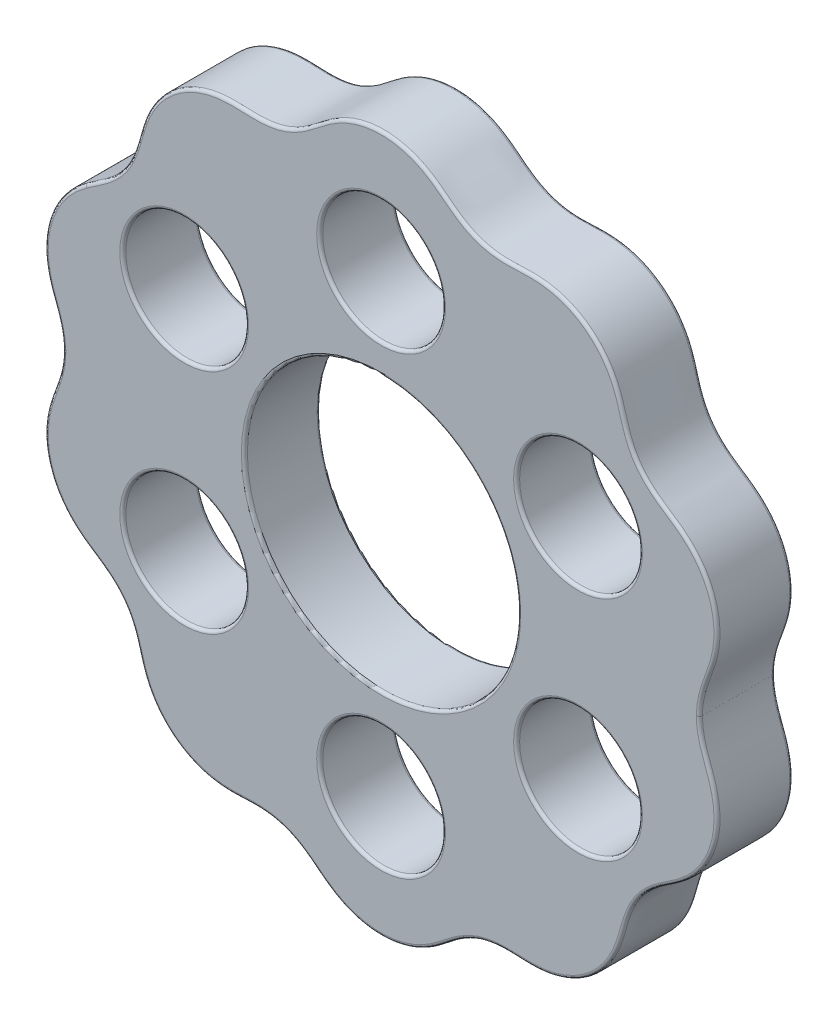
from build123d import *

# Parameters (mm, degrees)
EXTRUDE_2_OUTLINE_R   = 4.05
EXTRUDE_2_OUTLINE_R_2 = 9.025
EXTRUDE_2_DEPTH       = 5
FILLET_1_R            = 0.2


# Read off the part's stored shape, not the designer's step: 凸台-拉伸2
with BuildPart() as part:
    # 凸台-拉伸2 outline → 凸台-拉伸2 (new body)
    with BuildSketch(Plane.XY):
        with BuildLine():
            Line((21, 4.6e-08), (21, 0.003460893))
            add(Edge.make_bspline(
                [(21, 0.003460893), (21.000011266, 0.03628424), (21.00062988, 0.085518518), (21.002663687, 0.16758944), (21.008110281, 0.293673019), (21.0159383, 0.41500951), (21.03210052, 0.585956931), (21.062899635, 0.81813176), (21.111759858, 1.086790042), (21.183755453, 1.389774912), (21.269720123, 1.689533504), (21.366814407, 1.98553382), (21.47453945, 2.287562772), (21.589196835, 2.596568641), (21.735660872, 2.996140535), (21.901222759, 3.490830819), (22.05369515, 4.080881586), (22.165923512, 4.849511492), (22.175561982, 5.707357428), (22.040932637, 6.638885107), (21.722363772, 7.611223598), (21.277228746, 8.445803647), (20.754934362, 9.138042396), (20.200875847, 9.696733162), (19.650912408, 10.141901582), (18.957484306, 10.615454264), (18.139220779, 11.141829269), (17.283339145, 11.871815145), (16.54782015, 12.916021372), (16.091607449, 14.12397805), (15.79780589, 15.39419914), (15.338780856, 16.554361993), (14.688538834, 17.541608674), (13.919687145, 18.329771033), (13.08895669, 18.928412086), (12.085151784, 19.413891282), (10.912834503, 19.7241786), (9.64547333, 19.778749694), (8.331646776, 19.661593326), (7.021405447, 19.756075718), (5.782328555, 20.173503161), (4.689064439, 20.901898398), (3.694071993, 21.766220765), (2.634128574, 22.425472063), (1.53994112, 22.830761549), (0.462686872, 23.010709922), (-0.557410071, 23.003889745), (-1.652623077, 22.804099444), (-2.782384941, 22.363340908), (-3.83788403, 21.659989582), (-4.832122976, 20.793133633), (-5.949757468, 20.102495397), (-7.198693299, 19.715586097), (-8.511290503, 19.665862682), (-9.824305033, 19.77976039), (-11.06925682, 19.686944913), (-12.191853012, 19.36897978), (-13.167920002, 18.878856529), (-13.987690548, 18.271709749), (-14.75420712, 17.4643904), (-15.406717209, 16.442113578), (-15.844163217, 15.251772276), (-16.139318959, 13.966088885), (-16.641060529, 12.751690194), (-17.427133472, 11.706906515), (-18.461923059, 10.898036821), (-19.590766117, 10.21798853), (-20.541549347, 9.408554941), (-21.260494037, 8.489896044), (-21.75825794, 7.521030751), (-22.060736931, 6.553940815), (-22.204074189, 5.466484011), (-22.136191783, 4.284068726), (-21.80769729, 3.07883889), (-21.29637924, 1.877257188), (-20.973578766, 0.623797182), (-20.973445783, -0.655010406), (-21.295944724, -1.908523225), (-21.806441963, -3.110444086), (-22.133630435, -4.316061167), (-22.200239283, -5.498536937), (-22.055704697, -6.585842029), (-21.752175005, -7.552602259), (-21.253348491, -8.520915116), (-20.533405044, -9.438807061), (-19.581757813, -10.247183355), (-18.452395027, -10.92637628), (-17.417385267, -11.735006156), (-16.631095125, -12.779626649), (-16.12908583, -13.993889008), (-15.833105001, -15.279371687), (-15.394348485, -16.469266168), (-14.740746473, -17.490829618), (-13.973336649, -18.297309943), (-13.152907557, -18.903565222), (-12.176306528, -19.392612604), (-11.053356109, -19.709369457), (-9.808330604, -19.800822209), (-8.495397809, -19.685936175), (-7.182762692, -19.735339533), (-5.933746727, -20.121988971), (-4.815973885, -20.812358219), (-3.82117865, -21.678560103), (-2.764883833, -22.380776349), (-1.634660877, -22.820314721), (-0.539221443, -23.018900565), (0.480881563, -23.024612439), (1.557932362, -22.843480191), (2.65169358, -22.437006191), (3.710892731, -21.776611744), (4.705244142, -20.91154499), (5.798353228, -20.182870716), (7.037342423, -19.765185622), (8.3475383, -19.670401967), (9.661432013, -19.786692885), (10.92876623, -19.730734181), (12.100736309, -19.419189643), (13.104012619, -18.932602172), (13.934091778, -18.333060066), (14.702072406, -17.544054712), (15.351256954, -16.556098715), (15.809004326, -15.395457492), (16.10189084, -14.12502531), (16.557817346, -12.916925918), (17.293117926, -11.872580846), (18.148818497, -11.142392183), (18.966782976, -10.615583329), (19.659800264, -10.141408639), (20.209307724, -9.695679507), (20.762767875, -9.136390919), (21.284305769, -8.443583031), (21.728546592, -7.608483007), (22.046068256, -6.635722669), (22.179670413, -5.703943824), (22.169052128, -4.845983739), (22.055930268, -4.077371276), (21.902786014, -3.487406072), (21.736715528, -2.992809018), (21.589910598, -2.5932969), (21.475036772, -2.284319621), (21.367146885, -1.982298682), (21.269931305, -1.686287904), (21.183879136, -1.386505662), (21.11182384, -1.083485172), (21.062930913, -0.814792674), (21.032114576, -0.582581584), (21.01594463, -0.411610373), (21.008113265, -0.290258787), (21.002664554, -0.164156127), (21.000630063, -0.082069711), (21.000011267, -0.032828249), (21, 4.6e-08)],
                knots=[0.078603371, 0.078603371, 0.078603371, 0.078603371, 0.078603371, 0.079503105, 0.079952972, 0.080402839, 0.081302573, 0.082202307, 0.084001775, 0.085801242, 0.08760071, 0.089400177, 0.091199645, 0.092999113, 0.095007067, 0.097015021, 0.10103093, 0.105046838, 0.109062747, 0.114921576, 0.120780405, 0.126681855, 0.132583305, 0.136662363, 0.140741421, 0.144820479, 0.148899538, 0.156057349, 0.16321516, 0.170622241, 0.178029323, 0.185686693, 0.193344064, 0.199245485, 0.205146907, 0.211006631, 0.216866356, 0.224899172, 0.232931988, 0.240131044, 0.247330101, 0.255030618, 0.262731136, 0.270262596, 0.277794056, 0.283653722, 0.289513389, 0.295373126, 0.301232864, 0.309265611, 0.317298358, 0.324497485, 0.331696612, 0.339397151, 0.34709769, 0.354629127, 0.362160564, 0.368020217, 0.373879869, 0.37973962, 0.38559937, 0.39363205, 0.40166473, 0.408863939, 0.416063149, 0.423763692, 0.431464235, 0.438995653, 0.446527071, 0.452386709, 0.458246347, 0.464032282, 0.469818216, 0.477612945, 0.485407674, 0.492702211, 0.499996748, 0.507291262, 0.514585776, 0.522380518, 0.530175261, 0.535961193, 0.541747125, 0.547606765, 0.553466406, 0.560997827, 0.568529248, 0.576229791, 0.583930335, 0.59112953, 0.598328725, 0.606361416, 0.614394106, 0.620253855, 0.626113603, 0.631973258, 0.637832913, 0.645364353, 0.652895794, 0.660596331, 0.668296868, 0.675495982, 0.682695097, 0.690727855, 0.698760613, 0.704620348, 0.710480084, 0.716339753, 0.722199421, 0.729730886, 0.73726235, 0.744962862, 0.752663374, 0.759862421, 0.767061467, 0.775094294, 0.783127121, 0.788986844, 0.794846566, 0.80074799, 0.806649413, 0.814306793, 0.821964172, 0.829371248, 0.836778323, 0.843936122, 0.85109392, 0.855172983, 0.859252046, 0.863331109, 0.867410172, 0.87331162, 0.879213068, 0.885072764, 0.89093246, 0.894948945, 0.898965429, 0.902981914, 0.904990156, 0.906998398, 0.908798137, 0.910597876, 0.912397615, 0.914197354, 0.915997093, 0.917796832, 0.918696701, 0.919596571, 0.920046506, 0.92049644, 0.921396309, 0.921396309, 0.921396309, 0.921396309, 0.921396309], degree=4))
        make_face()
        with Locations((-12.990381057, -7.5)):
            Circle(EXTRUDE_2_OUTLINE_R, mode=Mode.SUBTRACT)
        with Locations((0, -15)):
            Circle(EXTRUDE_2_OUTLINE_R, mode=Mode.SUBTRACT)
        with Locations((12.990381057, -7.5)):
            Circle(EXTRUDE_2_OUTLINE_R, mode=Mode.SUBTRACT)
        with Locations((-12.990381057, 7.5)):
            Circle(EXTRUDE_2_OUTLINE_R, mode=Mode.SUBTRACT)
        Circle(EXTRUDE_2_OUTLINE_R_2, mode=Mode.SUBTRACT)
        with Locations((12.990381057, 7.5)):
            Circle(EXTRUDE_2_OUTLINE_R, mode=Mode.SUBTRACT)
        with Locations((0, 15)):
            Circle(EXTRUDE_2_OUTLINE_R, mode=Mode.SUBTRACT)
    extrude(amount=EXTRUDE_2_DEPTH)

    # 圆角1
    fillet_1_edges = [part.edges().sort_by_distance(p)[0] for p in [
        (-4.05, 15, 0),
        (-4.05, 15, 5),
        (8.940381057, 7.5, 0),
        (8.940381057, 7.5, 5),
        (8.940381057, -7.5, 0),
        (8.940381057, -7.5, 5),
        (-4.05, -15, 0),
        (-4.05, -15, 5),
        (-17.040381057, -7.5, 0),
        (-17.040381057, -7.5, 5),
        (-17.040381057, 7.5, 0),
        (-17.040381057, 7.5, 5),
        (21, 0.00173047, 0),
        (21, 0.00173047, 0),
        (21, 0.00173047, 5),
        (-9.025, 0, 0),
        (-9.025, 0, 5),
        (21, 0.00173047, 5),
    ]]
    fillet(fillet_1_edges, radius=FILLET_1_R)


solid = part.part
